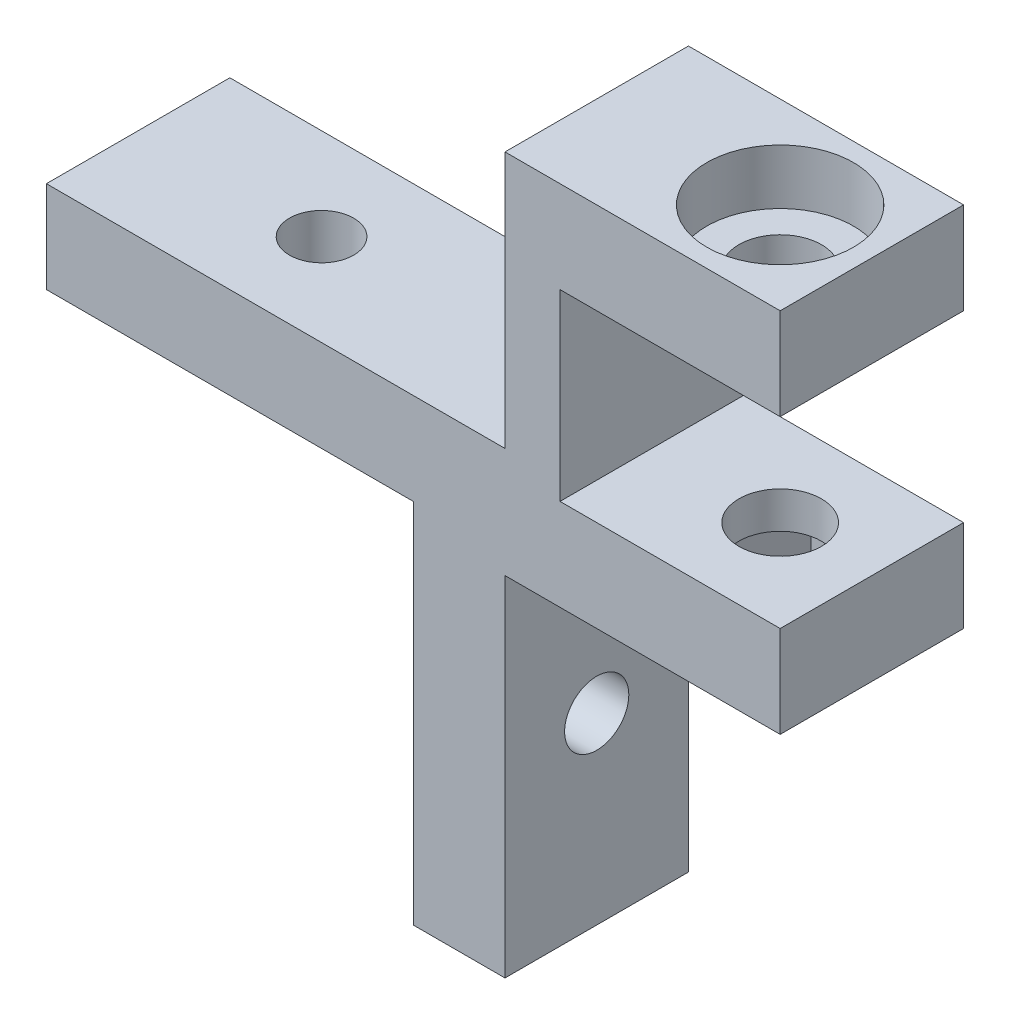
from build123d import *

# Parameters (mm, degrees)
SKETCH2_W                                           = 25
SKETCH2_H                                           = 25
BOSS_EXTRUDE1_DEPTH                                 = 10
SKETCH3_W                                           = 20
SKETCH3_H                                           = 20
CUT_EXTRUDE1_DEPTH                                  = 21.310096012
SKETCH5_W                                           = 10
SKETCH5_H                                           = 20
BOSS_EXTRUDE2_DEPTH                                 = 15
SKETCH7_W                                           = 12
SKETCH7_H                                           = 10
CUT_EXTRUDE2_DEPTH                                  = 40.477841886
SKETCH8_R                                           = 2.25
CUT_EXTRUDE3_DEPTH                                  = 49.757050772
SKETCH9_R                                           = 1.75
CUT_EXTRUDE4_DEPTH                                  = 15
SKETCH10_R                                          = 1.75
CUT_EXTRUDE5_DEPTH                                  = 15
CBORE_FOR_M4_HEX_SOCKET_HEAD_CAP_SCREW1_D           = 4.5
CBORE_FOR_M4_HEX_SOCKET_HEAD_CAP_SCREW1_CBORE_D     = 8
CBORE_FOR_M4_HEX_SOCKET_HEAD_CAP_SCREW1_CBORE_DEPTH = 3
CUT_EXTRUDE6_DEPTH                                  = 3


with BuildPart() as part:
    # Sketch2 → Boss-Extrude1 (new body)
    with BuildSketch(Plane.XY):
        Rectangle(SKETCH2_W, SKETCH2_H)
    extrude(amount=BOSS_EXTRUDE1_DEPTH)

    # Sketch3 → Cut-Extrude1 (cut, through all)
    with BuildSketch(Plane.XY.offset(10)):
        with Locations((-2.5, -2.5)):
            Rectangle(SKETCH3_W, SKETCH3_H)
    extrude(amount=-CUT_EXTRUDE1_DEPTH, mode=Mode.SUBTRACT)

    # Sketch5 → Boss-Extrude2 (add)
    with BuildSketch(Plane(origin=(12.5, 0, 0), x_dir=(0, 0, -1), z_dir=(1, 0, 0))):
        with Locations((-5, 16.5)):
            Rectangle(SKETCH5_W, SKETCH5_H)
    extrude(amount=BOSS_EXTRUDE2_DEPTH)

    # Sketch7 → Cut-Extrude2 (cut, through all)
    with BuildSketch(Plane.XY.offset(10)):
        with Locations((21.5, 16.5)):
            Rectangle(SKETCH7_W, SKETCH7_H)
    extrude(amount=-CUT_EXTRUDE2_DEPTH, mode=Mode.SUBTRACT)

    # Sketch8 → Cut-Extrude3 (cut, through all)
    with BuildSketch(Plane(origin=(0, 26.5, 0), x_dir=(1, 0, 0), z_dir=(0, 1, 0))):
        with Locations((22.5, -5)):
            Circle(SKETCH8_R)
    extrude(amount=-CUT_EXTRUDE3_DEPTH, mode=Mode.SUBTRACT)

    # Sketch9 → Cut-Extrude4 (cut)
    with BuildSketch(Plane(origin=(0, 12.5, 0), x_dir=(1, 0, 0), z_dir=(0, 1, 0))):
        with Locations((-2.5, -5)):
            Circle(SKETCH9_R)
    extrude(amount=-CUT_EXTRUDE4_DEPTH, mode=Mode.SUBTRACT)

    # Sketch10 → Cut-Extrude5 (cut)
    with BuildSketch(Plane(origin=(12.5, 0, 0), x_dir=(0, 0, -1), z_dir=(1, 0, 0))):
        with Locations((-5, -2.5)):
            Circle(SKETCH10_R)
    extrude(amount=-CUT_EXTRUDE5_DEPTH, mode=Mode.SUBTRACT)

    # CBORE for M4 Hex Socket Head Cap Screw1 (through all)
    with Locations(Plane(origin=(0, 26.5, 0), x_dir=(1, 0, 0), z_dir=(0, 1, 0))):
        with Locations((22.5, -5)):
            CounterBoreHole(CBORE_FOR_M4_HEX_SOCKET_HEAD_CAP_SCREW1_D / 2, CBORE_FOR_M4_HEX_SOCKET_HEAD_CAP_SCREW1_CBORE_D / 2, CBORE_FOR_M4_HEX_SOCKET_HEAD_CAP_SCREW1_CBORE_DEPTH)

    # Sketch13 → Cut-Extrude6 (cut)
    with BuildSketch(Plane.XZ.offset(-6.5)):
        Polygon((17.881197846, 5), (20.190598923, 1), (24.809401077, 1), (27.118802154, 5), (24.809401077, 9), (20.190598923, 9), align=None)
    extrude(amount=-CUT_EXTRUDE6_DEPTH, mode=Mode.SUBTRACT)


solid = part.part
